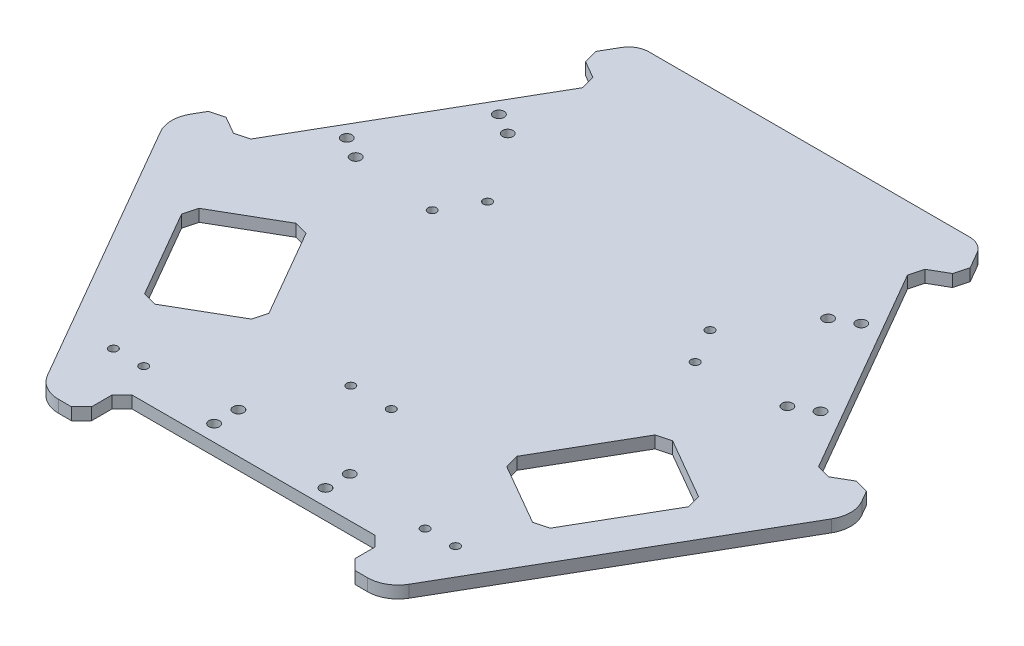
from build123d import *

# Parameters (mm, degrees)
EXTRUDE_1_DEPTH            = 6
SKETCH_16_W                = 130
SKETCH_16_H                = 20
CUT_EXTRUDE_16_DEPTH       = 10
SKETCH_9_R                 = 2.6
CUT_EXTRUDE_8_DEPTH        = 225.968886738
CUT_EXTRUDE_17_REACH       = 226.969
SKETCH_18_R                = 2.1
PATTERN_CIRCULAR_1_COUNT   = 3
CHAMFER_4_SIZE             = 5
SKETCH_5_R                 = 2.1
CUT_EXTRUDE_5_DEPTH        = 225.968886738
CUT_EXTRUDE_7_DEPTH        = 225.968886738
CHAMFER_2_SIZE             = 5
CHAMFER_2_OF_MIRROR_1_SIZE = 5
FILLET_2_R                 = 15
FILLET_3_R                 = 10


with BuildPart() as part:
    # 草圖1 → 填料-伸長1 (new body)
    with BuildSketch(Plane(origin=(0, 0, 0), x_dir=(1, 0, 0), z_dir=(0, 1, 0))):
        Polygon((85, 147.224318643), (-85, 147.224318643), (-170, 0), (-85, -147.224318643), (85, -147.224318643), (170, 0), align=None)
    extrude(amount=EXTRUDE_1_DEPTH)

    # 草圖16 → 除料-伸長16 (cut)
    with BuildSketch(Plane(origin=(0, 6, 0), x_dir=(1, 0, 0), z_dir=(0, 1, 0))):
        with Locations((0, -137.224318643)):
            Rectangle(SKETCH_16_W, SKETCH_16_H)
    cut_extrude_16 = extrude(amount=-CUT_EXTRUDE_16_DEPTH, mode=Mode.SUBTRACT)

    # 草圖9 → 除料-伸長8 (cut, symmetric)
    with BuildSketch(Plane(origin=(0, 6, 0), x_dir=(1, 0, 0), z_dir=(0, 1, 0))):
        with Locations((-27.5, -119.224318643)):
            Circle(SKETCH_9_R)
        with Locations((-27.5, -107.224318643)):
            Circle(SKETCH_9_R)
        with Locations((27.5, -107.224318643)):
            Circle(SKETCH_9_R)
        with Locations((27.5, -119.224318643)):
            Circle(SKETCH_9_R)
    cut_extrude_8 = extrude(amount=CUT_EXTRUDE_8_DEPTH, both=True, mode=Mode.SUBTRACT)

    # 草圖18 → 除料-伸長17 (cut, up to next)
    with BuildSketch(Plane(origin=(0, 6, 0), x_dir=(1, 0, 0), z_dir=(0, 1, 0)), mode=Mode.PRIVATE) as cut_extrude_17_sk1:
        with Locations((-10, -69.224318643)):
            Circle(SKETCH_18_R)
    cut_extrude_17_tool1 = extrude(cut_extrude_17_sk1.sketch, amount=-CUT_EXTRUDE_17_REACH, mode=Mode.PRIVATE) & part.part
    # 草圖18 → 除料-伸長17 (cut, up to next)
    with BuildSketch(Plane(origin=(0, 6, 0), x_dir=(1, 0, 0), z_dir=(0, 1, 0)), mode=Mode.PRIVATE) as cut_extrude_17_sk2:
        with Locations((10, -69.224318643)):
            Circle(SKETCH_18_R)
    cut_extrude_17_tool2 = extrude(cut_extrude_17_sk2.sketch, amount=-CUT_EXTRUDE_17_REACH, mode=Mode.PRIVATE) & part.part
    cut_extrude_17_1 = cut_extrude_17_tool1.solids().sort_by_distance((-10, 6, 69.224319))[0]
    add(cut_extrude_17_1, mode=Mode.SUBTRACT)
    cut_extrude_17_2 = cut_extrude_17_tool2.solids().sort_by_distance((10, 6, 69.224319))[0]
    add(cut_extrude_17_2, mode=Mode.SUBTRACT)
    cut_extrude_17 = cut_extrude_17_1 + cut_extrude_17_2  # 除料-伸長17 as one shape, for the pattern or mirror that repeats it

    # 環狀複製排列1: 除料-伸長16, 除料-伸長8, 除料-伸長17 ×3 about axis
    pattern_circular_1_axis = Axis((0, 5.25, 0), (0, -1, 0))
    add([cut_extrude_16.rotate(pattern_circular_1_axis, i * 360 / PATTERN_CIRCULAR_1_COUNT) for i in range(1, PATTERN_CIRCULAR_1_COUNT)], mode=Mode.SUBTRACT)
    add([cut_extrude_8.rotate(pattern_circular_1_axis, i * 360 / PATTERN_CIRCULAR_1_COUNT) for i in range(1, PATTERN_CIRCULAR_1_COUNT)], mode=Mode.SUBTRACT)
    add([cut_extrude_17.rotate(pattern_circular_1_axis, i * 360 / PATTERN_CIRCULAR_1_COUNT) for i in range(1, PATTERN_CIRCULAR_1_COUNT)], mode=Mode.SUBTRACT)

    # 導角4
    chamfer_4_edges = [part.edges().sort_by_distance(p)[0] for p in [
        (65, 3, 127.224318643),
        (65, 3, 147.224318643),
        (-65, 3, 147.224318643),
        (-65, 3, 127.224318643),
        (77.679491924, 3, -119.903810568),
        (95, 3, -129.903810568),
        (160, 3, -17.320508076),
        (142.679491924, 3, -7.320508076),
        (-142.679491924, 3, -7.320508076),
        (-160, 3, -17.320508076),
        (-95, 3, -129.903810568),
        (-77.679491924, 3, -119.903810568),
    ]]
    chamfer(chamfer_4_edges, length=CHAMFER_4_SIZE)

    # 草圖5 → 除料-伸長5 (cut, through all)
    with BuildSketch(Plane(origin=(0, 6, 0), x_dir=(1, 0, 0), z_dir=(0, 1, 0))):
        with Locations((-84.5, -112)):
            Circle(SKETCH_5_R)
        with Locations((-69.5, -112)):
            Circle(SKETCH_5_R)
        with Locations((84.5, -112)):
            Circle(SKETCH_5_R)
        with Locations((69.5, -112)):
            Circle(SKETCH_5_R)
    extrude(amount=-CUT_EXTRUDE_5_DEPTH, mode=Mode.SUBTRACT)

    # 草圖8 → 除料-伸長7 (cut, through all)
    with BuildSketch(Plane(origin=(0, 6, 0), x_dir=(1, 0, 0), z_dir=(0, 1, 0))):
        Polygon((-127.679491924, -33.301270189), (-97.679491924, -85.262794416), (-58.708348754, -62.762794416), (-88.708348754, -10.801270189), align=None)
    cut_extrude_7 = extrude(amount=-CUT_EXTRUDE_7_DEPTH, mode=Mode.SUBTRACT)

    # 導角2
    chamfer_2_edges = [part.edges().sort_by_distance(p)[0] for p in [
        (-58.708348754, 3, 62.762794416),
        (-97.679491924, 3, 85.262794416),
        (-127.679491924, 3, 33.301270189),
        (-88.708348754, 3, 10.801270189),
    ]]
    chamfer(chamfer_2_edges, length=CHAMFER_2_SIZE)

    # 鏡射1: 除料-伸長7 across plane
    add(cut_extrude_7.mirror(Plane(origin=(0, 0, 0), x_dir=(0, 0, 1), z_dir=(1, 0, 0))), mode=Mode.SUBTRACT)

    # 導角2 of 鏡射1
    chamfer_2_of_mirror_1_edges = [part.edges().sort_by_distance(p)[0] for p in [
        (58.708348754, 3, 62.762794416),
        (97.679491924, 3, 85.262794416),
        (127.679491924, 3, 33.301270189),
        (88.708348754, 3, 10.801270189),
    ]]
    chamfer(chamfer_2_of_mirror_1_edges, length=CHAMFER_2_OF_MIRROR_1_SIZE)

    # 圓角2
    fillet_2_edges = [part.edges().sort_by_distance(p)[0] for p in [
        (-170, 3, 0),
        (-85, 3, 147.224318643),
        (85, 3, 147.224318643),
        (170, 3, 0),
    ]]
    fillet(fillet_2_edges, radius=FILLET_2_R)

    # 圓角3
    fillet_3_edges = [part.edges().sort_by_distance(p)[0] for p in [
        (85, 3, -147.224318643),
        (-85, 3, -147.224318643),
    ]]
    fillet(fillet_3_edges, radius=FILLET_3_R)


solid = part.part
